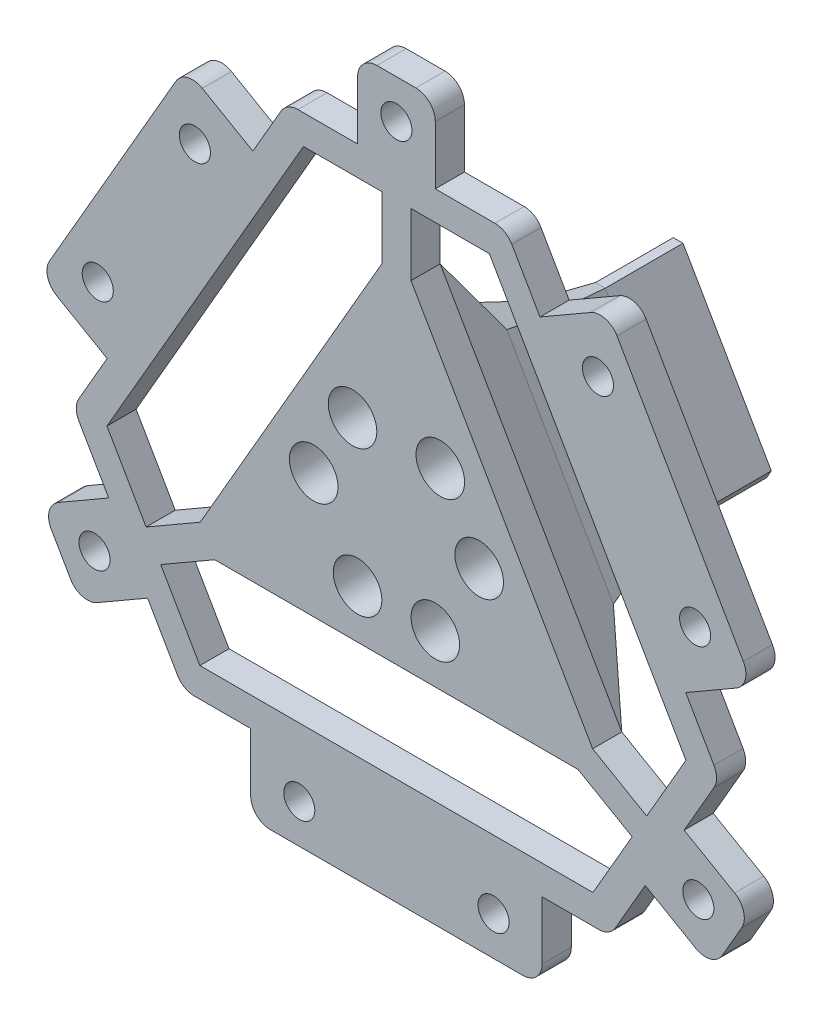
from build123d import *

# Parameters (mm, degrees)
UNUSED1_DEPTH       = 8
LOFT11_DEPTH        = 6
LOFT11_DRAFT        = -19.9677704
LOFT16_DEPTH        = 6
LOFT16_DRAFT        = -29.9706156
BOSS_EXTRUDE7_DEPTH = 3
SKETCH27_R          = 1.6
SKETCH27_W          = 8
SKETCH27_H          = 8
SKETCH27_W_2        = 30
BOSS_EXTRUDE9_DEPTH = 3
SKETCH27_3_R        = 2.5
CUT_EXTRUDE1_DEPTH  = 4
FILLET1_R           = 2


# Read off the part's stored shape, not the designer's step: Loft11, Loft16
with BuildPart() as part:
    # Sketch1 → UNUsed1 (new body)
    with BuildSketch(Plane.XY):
        Polygon((-0.5, 10.786533479), (-9.591412012, -4.960254038), (-9.091412012, -5.826279442), (9.091412012, -5.826279442), (9.591412012, -4.960254038), (0.5, 10.786533479), align=None)
    extrude(amount=-UNUSED1_DEPTH)

    # Sketch1<31> → Loft10 section 0
    with BuildSketch(Plane.XY):
        with BuildLine():
            Line((-0.5, 10.786533479), (-9.591412012, -4.960254038))
            Line((-9.591412012, -4.960254038), (-9.091412012, -5.826279442))
            Line((-9.091412012, -5.826279442), (9.091412012, -5.826279442))
            Line((9.091412012, -5.826279442), (9.591412012, -4.960254038))
            Line((9.591412012, -4.960254038), (0.5, 10.786533479))
            Line((0.5, 10.786533479), (-0.5, 10.786533479))
        make_face()
    # Sketch15 → Loft10 section 1
    with BuildSketch(Plane.XY.offset(6)):
        with BuildLine():
            Line((1.111991285, 11.846533479), (-1.111991285, 11.846533479))
            Line((-1.111991285, 11.846533479), (-10.815394583, -4.960254038))
            Line((-10.815394583, -4.960254038), (-9.703403297, -6.886279442))
            Line((-9.703403297, -6.886279442), (9.703403297, -6.886279442))
            Line((9.703403297, -6.886279442), (10.815394583, -4.960254038))
            Line((10.815394583, -4.960254038), (1.111991285, 11.846533479))
        make_face()
    loft()


with BuildPart() as loft11_tool:
    # Loft11 outline → Loft11 (with draft: the straight prism first)
    with BuildSketch(Plane.XY.offset(12)):
        Polygon((-13.332641756, -4.960254038), (-10.962026884, -9.066279442), (10.962026884, -9.066279442), (13.332641756, -4.960254038), (2.370614872, 14.026533479), (-2.370614872, 14.026533479), align=None)
    extrude(amount=-LOFT11_DEPTH)
    # Loft11: the draft: its side faces are tilted about the plane it starts from
    loft11_sides = [loft11_tool.faces().sort_by_distance(p)[0] for p in [
        (-12.14733432, -7.01326674, 9),
        (0, -9.066279442, 9),
        (12.14733432, -7.01326674, 9),
        (7.851628314, 4.533139721, 9),
        (0, 14.026533479, 9),
        (-7.851628314, 4.53313972, 9),
    ]]
    draft(loft11_sides, Plane.XY.offset(12), LOFT11_DRAFT)


with BuildPart() as part_1:
    add(part.part)

    # Loft11: add loft11_tool
    add(loft11_tool.part)


with BuildPart() as loft16_tool:
    # Loft16 outline → Loft16 (with draft: the straight prism first)
    with BuildSketch(Plane.XY.offset(18)):
        Polygon((4.368246804, 17.486533479), (-4.368246804, 17.486533479), (-17.327905619, -4.960254038), (-12.959658816, -12.526279442), (12.959658816, -12.526279442), (17.327905619, -4.960254038), align=None)
    extrude(amount=-LOFT16_DEPTH)
    # Loft16: the draft: its side faces are tilted about the plane it starts from
    loft16_sides = [loft16_tool.faces().sort_by_distance(p)[0] for p in [
        (0, 17.486533479, 15),
        (-10.848076212, 6.26313972, 15),
        (-15.143782217, -8.74326674, 15),
        (0, -12.526279442, 15),
        (15.143782218, -8.74326674, 15),
        (10.848076211, 6.263139721, 15),
    ]]
    draft(loft16_sides, Plane.XY.offset(18), LOFT16_DRAFT)


with BuildPart() as part_2:
    add(part_1.part)

    # Loft16: add loft16_tool
    add(loft16_tool.part)



with BuildPart() as body_2:
    # Sketch23 → Boss-Extrude7 (new body)
    with BuildSketch(Plane.XY.offset(18)):
        Polygon((21.962990915, -25.726279442), (33.261106999, -6.157368355), (11.298116084, 31.883647797), (-11.298116084, 31.883647797), (-33.261106999, -6.157368355), (-21.962990915, -25.726279442), align=None)
        Polygon((14.393782217, -10.042304845), (24.263972746, -15.740862004), (20.230940108, -22.726279442), (-20.230940108, -22.726279442), (-24.263972746, -15.740862004), (-14.393782217, -10.042304845), (-12.959658816, -12.526279442), (12.959658816, -12.526279442), align=None, mode=Mode.SUBTRACT)
        Polygon((-15.893782217, -7.444228634), (-25.763972746, -13.142785793), (-29.797005384, -6.157368355), (-9.566065276, 28.883647797), (-1.5, 28.883647797), (-1.5, 17.486533479), (-4.368246804, 17.486533479), (-17.327905619, -4.960254038), align=None, mode=Mode.SUBTRACT)
        Polygon((29.797005384, -6.157368355), (25.763972746, -13.142785793), (15.893782217, -7.444228634), (17.327905619, -4.960254038), (4.368246804, 17.486533479), (1.5, 17.486533479), (1.5, 28.883647797), (9.566065276, 28.883647797), align=None, mode=Mode.SUBTRACT)
    extrude(amount=BOSS_EXTRUDE7_DEPTH)


with BuildPart() as part_3:
    add(part_2.part)

    add(body_2.part)  # Loft19 merges body 2
    # Sketch26 → Loft19 section 0
    with BuildSketch(Plane.XY.offset(12)):
        with BuildLine():
            Line((-2.370614872, 14.026533479), (2.370614872, 14.026533479))
            Line((2.370614872, 14.026533479), (13.332641756, -4.960254038))
            Line((13.332641756, -4.960254038), (10.962026884, -9.066279442))
            Line((10.962026884, -9.066279442), (-10.962026884, -9.066279442))
            Line((-10.962026884, -9.066279442), (-13.332641756, -4.960254038))
            Line((-13.332641756, -4.960254038), (-2.370614872, 14.026533479))
        make_face()
    # Sketch25 → Loft19 section 1
    with BuildSketch(Plane.XY.offset(18)):
        with BuildLine():
            Line((20.196152423, -9.92820323), (1.5, 22.454482672))
            Line((1.5, 22.454482672), (-1.5, 22.454482672))
            Line((-1.5, 22.454482672), (-20.196152423, -9.92820323))
            Line((-20.196152423, -9.92820323), (-18.696152423, -12.526279442))
            Line((-18.696152423, -12.526279442), (18.696152423, -12.526279442))
            Line((18.696152423, -12.526279442), (20.196152423, -9.92820323))
        make_face()
    loft()

    # Sketch27 → Boss-Extrude9 (add)
    # profile 1 of 12: a face of its own
    with BuildSketch(Plane.XY.offset(21)):
        Polygon((-36.707814772, 3.872758664), (-29.779611541, -0.127241336), (-14.779611541, 25.853520778), (-21.707814772, 29.853520778), align=None)
        with Locations((-30.743713156, 6.202885683)):
            Circle(SKETCH27_R, mode=Mode.SUBTRACT)
        with Locations((-20.743713156, 23.523393759)):
            Circle(SKETCH27_R, mode=Mode.SUBTRACT)
    # profile 2 of 12: a face of its own
    with BuildSketch(Plane.XY.offset(21)):
        with Locations((0, 35.883647797)):
            Rectangle(SKETCH27_W, SKETCH27_H)
        with Locations((0, 35.883647797)):
            Circle(SKETCH27_R, mode=Mode.SUBTRACT)
    # profile 3 of 12: a face of its own
    with BuildSketch(Plane.XY.offset(21)):
        Polygon((36.540252187, -16.477722283), (29.612048957, -12.477722283), (25.612048957, -19.405925513), (32.540252187, -23.405925513), align=None)
        with Locations((31.076150572, -17.941823898)):
            Circle(SKETCH27_R, mode=Mode.SUBTRACT)
    # profile 4 of 12: a face of its own
    with BuildSketch(Plane.XY.offset(21)):
        Polygon((29.779611541, -0.127241336), (36.707814772, 3.872758664), (21.707814772, 29.853520778), (14.779611541, 25.853520778), align=None)
        with Locations((30.743713156, 6.202885683)):
            Circle(SKETCH27_R, mode=Mode.SUBTRACT)
        with Locations((20.743713156, 23.523393759)):
            Circle(SKETCH27_R, mode=Mode.SUBTRACT)
    # profile 5 of 12: a face of its own
    with BuildSketch(Plane.XY.offset(21)):
        Polygon((-32.540252187, -23.405925513), (-25.612048957, -19.405925513), (-29.612048957, -12.477722283), (-36.540252187, -16.477722283), align=None)
        with Locations((-31.076150572, -17.941823898)):
            Circle(SKETCH27_R, mode=Mode.SUBTRACT)
    # profile 6 of 12: a face of its own
    with BuildSketch(Plane.XY.offset(21)):
        with Locations((0, -29.726279442)):
            Rectangle(SKETCH27_W_2, SKETCH27_H)
        with Locations((-10, -29.726279442)):
            Circle(SKETCH27_R, mode=Mode.SUBTRACT)
        with Locations((10, -29.726279442)):
            Circle(SKETCH27_R, mode=Mode.SUBTRACT)
    # profile 7 of 12: a face of its own
    with BuildSketch(Plane.XY.offset(21)):
        Polygon((4.368246804, 17.486533479), (1.5, 22.454482672), (1.5, 17.486533479), align=None)
    # profile 8 of 12: a face of its own
    with BuildSketch(Plane.XY.offset(21)):
        Polygon((-1.5, 17.486533479), (-1.5, 22.454482672), (-4.368246804, 17.486533479), align=None)
    # profile 9 of 12: a face of its own
    with BuildSketch(Plane.XY.offset(21)):
        Polygon((14.393782217, -10.042304845), (12.959658816, -12.526279442), (18.696152423, -12.526279442), align=None)
    # profile 10 of 12: a face of its own
    with BuildSketch(Plane.XY.offset(21)):
        Polygon((15.893782217, -7.444228634), (20.196152423, -9.92820323), (17.327905619, -4.960254038), align=None)
    # profile 11 of 12: a face of its own
    with BuildSketch(Plane.XY.offset(21)):
        Polygon((-15.893782217, -7.444228634), (-17.327905619, -4.960254038), (-20.196152423, -9.92820323), align=None)
    # profile 12 of 12: a face of its own
    with BuildSketch(Plane.XY.offset(21)):
        Polygon((-14.393782217, -10.042304845), (-18.696152423, -12.526279442), (-12.959658816, -12.526279442), align=None)
    extrude(amount=-BOSS_EXTRUDE9_DEPTH)

    # Sketch27<3> → Cut-Extrude1 (cut)
    with BuildSketch(Plane.XY.offset(21)):
        with Locations((4.517949192, 7.227241336)):
            Circle(SKETCH27_3_R)
        with Locations((8.517949192, 0.299038106)):
            Circle(SKETCH27_3_R)
        with Locations((4, -7.526279442)):
            Circle(SKETCH27_3_R)
        with Locations((-4, -7.526279442)):
            Circle(SKETCH27_3_R)
        with Locations((-8.517949192, 0.299038106)):
            Circle(SKETCH27_3_R)
        with Locations((-4.517949192, 7.227241336)):
            Circle(SKETCH27_3_R)
    extrude(amount=-CUT_EXTRUDE1_DEPTH, mode=Mode.SUBTRACT)

    # Fillet1
    fillet1_edges = [part_3.edges().sort_by_distance(p)[0] for p in [
        (-33.261106999, -6.157368355, 19.5),
        (-21.962990915, -25.726279442, 19.5),
        (21.962990915, -25.726279442, 19.5),
        (33.261106999, -6.157368355, 19.5),
        (11.298116084, 31.883647797, 19.5),
        (-11.298116084, 31.883647797, 19.5),
        (32.540252187, -23.405925513, 19.5),
        (36.540252187, -16.477722283, 19.5),
        (36.707814772, 3.872758664, 19.5),
        (21.707814772, 29.853520778, 19.5),
        (4, 39.883647797, 19.5),
        (-4, 39.883647797, 19.5),
        (-21.707814772, 29.853520778, 19.5),
        (-36.707814772, 3.872758664, 19.5),
        (-36.540252187, -16.477722283, 19.5),
        (-32.540252187, -23.405925513, 19.5),
        (-15, -33.726279442, 19.5),
        (15, -33.726279442, 19.5),
    ]]
    fillet(fillet1_edges, radius=FILLET1_R)


solid = part_3.part
